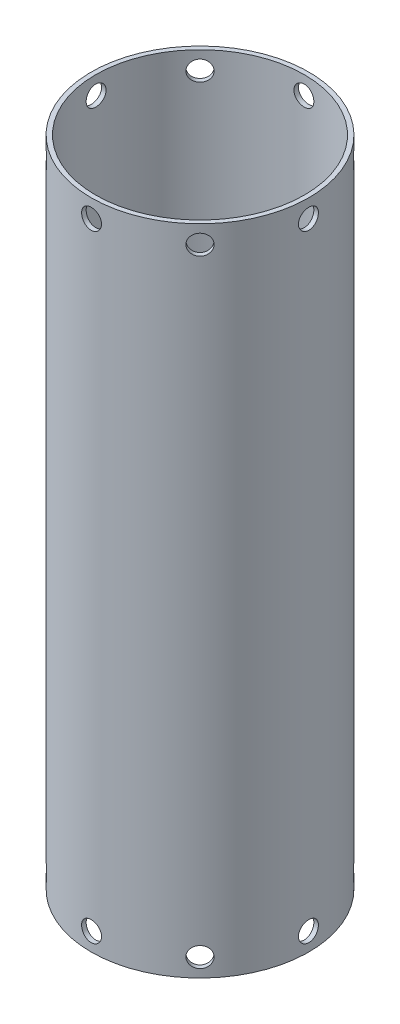
from build123d import *

# Parameters (mm, degrees)
SKETCH1_R               = 76.2
SKETCH1_R_2             = 73.025
BOSS_EXTRUDE1_DEPTH     = 457.2
CUT_EXTRUDE1_REACH      = 447.044
CUT_EXTRUDE1_END_RADIUS = 76.2
SKETCH4_R               = 6.985
CIRPATTERN3_COUNT       = 8
CUT_EXTRUDE2_REACH      = 447.044
CUT_EXTRUDE2_END_RADIUS = 76.2
SKETCH7_R               = 6.985
CIRPATTERN4_COUNT       = 8


with BuildPart() as part:
    # Sketch1 → Boss-Extrude1 (new body)
    with BuildSketch(Plane(origin=(0, 0, 0), x_dir=(1, 0, 0), z_dir=(0, 1, 0))):
        Circle(SKETCH1_R)
        Circle(SKETCH1_R_2, mode=Mode.SUBTRACT)
    extrude(amount=BOSS_EXTRUDE1_DEPTH)

    # Cut-Extrude1: up to this cylinder (the profile starts inside it)
    cut_extrude1_end = Plane(origin=(0, 444.5, 0), z_dir=(0, -1, 0)) * Cylinder(CUT_EXTRUDE1_END_RADIUS, 1047.488, mode=Mode.PRIVATE)
    # Sketch4 → Cut-Extrude1 (cut, up to the surface)
    with BuildSketch(Plane(origin=(0, 431.8, 0), x_dir=(0, 0, 1), z_dir=(1, 0, 0)), mode=Mode.PRIVATE) as cut_extrude1_sk1:
        with Locations((0, -12.7)):
            Circle(SKETCH4_R)
    cut_extrude1_tool1 = extrude(cut_extrude1_sk1.sketch, amount=CUT_EXTRUDE1_REACH, mode=Mode.PRIVATE) & cut_extrude1_end
    cut_extrude1 = cut_extrude1_tool1.solids().sort_by_distance((0, 444.5, 0))[0]
    add(cut_extrude1, mode=Mode.SUBTRACT)

    # CirPattern3: Cut-Extrude1 ×8 about axis
    cirpattern3_axis = Axis((0, 457.2, 0), (0, 1, 0))
    for i in range(1, CIRPATTERN3_COUNT):
        add(cut_extrude1.rotate(cirpattern3_axis, i * 360 / CIRPATTERN3_COUNT), mode=Mode.SUBTRACT)

    # Cut-Extrude2: up to this cylinder (the profile starts inside it)
    cut_extrude2_end = Plane(origin=(0, 12.7, 0), z_dir=(0, -1, 0)) * Cylinder(CUT_EXTRUDE2_END_RADIUS, 1047.488, mode=Mode.PRIVATE)
    # Sketch7 → Cut-Extrude2 (cut, up to the surface)
    with BuildSketch(Plane(origin=(0, 25.4, 0), x_dir=(0, 0, -1), z_dir=(1, 0, 0)), mode=Mode.PRIVATE) as cut_extrude2_sk1:
        with Locations((0, -12.7)):
            Circle(SKETCH7_R)
    cut_extrude2_tool1 = extrude(cut_extrude2_sk1.sketch, amount=CUT_EXTRUDE2_REACH, mode=Mode.PRIVATE) & cut_extrude2_end
    cut_extrude2 = cut_extrude2_tool1.solids().sort_by_distance((0, 12.7, 0))[0]
    add(cut_extrude2, mode=Mode.SUBTRACT)

    # CirPattern4: Cut-Extrude2 ×8 about axis
    cirpattern4_axis = Axis((0, 0, 0), (0, 1, 0))
    for i in range(1, CIRPATTERN4_COUNT):
        add(cut_extrude2.rotate(cirpattern4_axis, i * 360 / CIRPATTERN4_COUNT), mode=Mode.SUBTRACT)


solid = part.part
